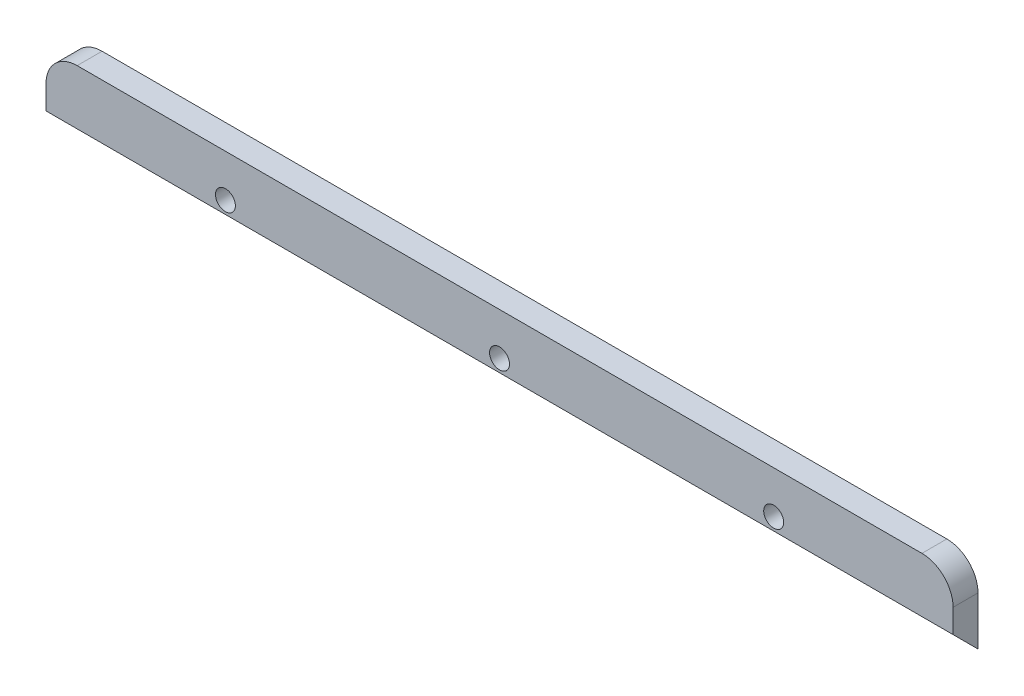
from build123d import *

# Parameters (mm, degrees)
BOSS_EXTRUDE1_DEPTH   = 36.4
M2X0_4_TAPPED_HOLE1_D = 1.6
FILLET3_R             = 2.5


with BuildPart() as part:
    # Sketch1 → Boss-Extrude1 (new, symmetric)
    with BuildSketch(Plane(origin=(0, 0, 0), x_dir=(0, 0, -1), z_dir=(1, 0, 0))):
        Polygon((0, -3.2), (-2, -1.2), (-2, 3.2), (0, 3.2), align=None)
    extrude(amount=BOSS_EXTRUDE1_DEPTH, both=True)

    # M2x0.4 Tapped Hole1 (through all)
    with Locations(Plane.XY.offset(2)):
        with Locations((-22, -0.2), (0, -0.2), (22, -0.2)):
            Hole(M2X0_4_TAPPED_HOLE1_D / 2)

    # Fillet3
    fillet3_edges = [part.edges().sort_by_distance(p)[0] for p in [
        (-36.4, 3.2, 1),
        (36.4, 3.2, 1),
    ]]
    fillet(fillet3_edges, radius=FILLET3_R)


solid = part.part
